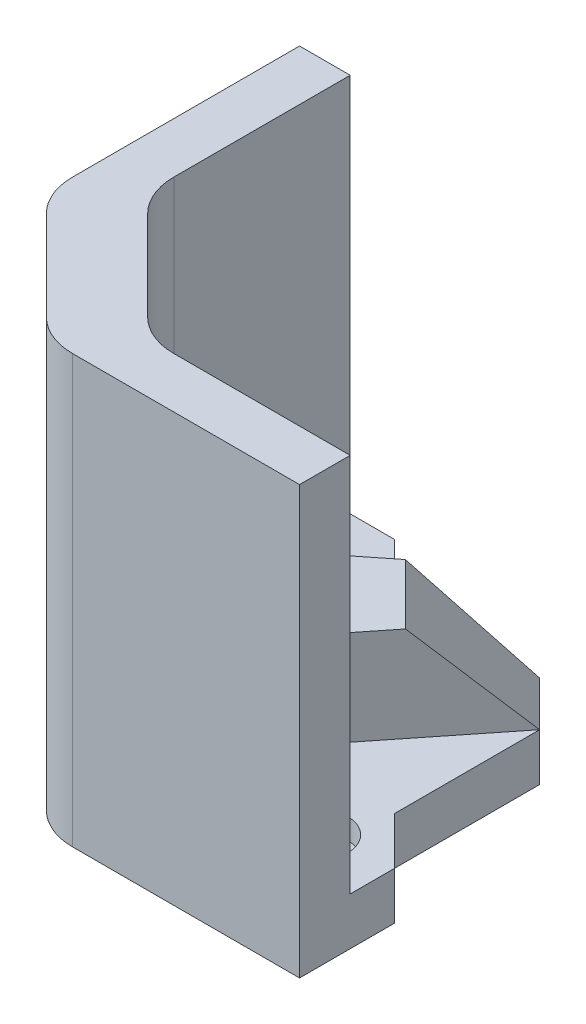
from build123d import *

# Parameters (mm, degrees)
BOSS_EXTRUDE1_DEPTH                                  = 7.5
BOSS_EXTRUDE2_DEPTH                                  = 60
CHAMFER1_SIZE                                        = 20
FILLET2_R                                            = 10
SKETCH3_R                                            = 2.7
CUT_EXTRUDE1_DEPTH                                   = 104.923048454
REFRENTADO_PARA_TORNILLO_CON_CABEZA_PLAN_D           = 5.3
REFRENTADO_PARA_TORNILLO_CON_CABEZA_PLAN_CBORE_D     = 10
REFRENTADO_PARA_TORNILLO_CON_CABEZA_PLAN_CBORE_DEPTH = 3.3
BOSS_EXTRUDE3_DEPTH                                  = 15
CHAMFER2_SIZE                                        = 15


with BuildPart() as part:
    # Sketch1 → Boss-Extrude1 (new body)
    with BuildSketch(Plane(origin=(0, 0, 0), x_dir=(1, 0, 0), z_dir=(0, 1, 0))):
        Polygon((0, 0), (0, 60), (15, 60), (22.5, 52.5), (45.428932188, 52.5), (52.5, 45.428932188), (52.5, 22.5), (60, 15), (60, 0), align=None)
    extrude(amount=BOSS_EXTRUDE1_DEPTH)

    # Sketch2 → Boss-Extrude2 (add)
    with BuildSketch(Plane(origin=(0, 7.5, 0), x_dir=(1, 0, 0), z_dir=(0, 1, 0))):
        Polygon((0, 60), (0, 0), (60, 0), (60, 8), (8, 8), (8, 60), align=None)
    extrude(amount=BOSS_EXTRUDE2_DEPTH)

    # Chamfer1
    chamfer1_edges = [part.edges().sort_by_distance(p)[0] for p in [
        (0, 33.75, 0),
        (8, 37.5, -8),
    ]]
    chamfer(chamfer1_edges, length=CHAMFER1_SIZE)

    # Fillet2
    fillet2_edges = [part.edges().sort_by_distance(p)[0] for p in [
        (0, 33.75, -20),
        (20, 33.75, 0),
        (28, 37.5, -8),
        (8, 37.5, -28),
    ]]
    fillet(fillet2_edges, radius=FILLET2_R)

    # Sketch3 → Cut-Extrude1 (cut, through all)
    with BuildSketch(Plane(origin=(0, 7.5, 0), x_dir=(1, 0, 0), z_dir=(0, 1, 0))):
        with Locations((36.6, 13.4)):
            Circle(SKETCH3_R)
        with Locations((49.187905991, 13.4)):
            Circle(SKETCH3_R)
        with Locations((13.4, 49.187905991)):
            Circle(SKETCH3_R)
        with Locations((13.4, 36.6)):
            Circle(SKETCH3_R)
    extrude(amount=-CUT_EXTRUDE1_DEPTH, mode=Mode.SUBTRACT)

    # Refrentado para tornillo con cabeza plana de M51 (through all)
    with Locations(Plane(origin=(0, 7.5, 0), x_dir=(1, 0, 0), z_dir=(0, 1, 0))):
        with Locations((13.4, 49.187905991), (13.4, 36.6), (36.6, 13.4), (49.187905991, 13.4)):
            CounterBoreHole(REFRENTADO_PARA_TORNILLO_CON_CABEZA_PLAN_D / 2, REFRENTADO_PARA_TORNILLO_CON_CABEZA_PLAN_CBORE_D / 2, REFRENTADO_PARA_TORNILLO_CON_CABEZA_PLAN_CBORE_DEPTH)

    # Sketch5 → Boss-Extrude3 (add)
    with BuildSketch(Plane(origin=(0, 7.5, 0), x_dir=(1, 0, 0), z_dir=(0, 1, 0))):
        Polygon((45.428932188, 52.5), (10.928932188, 25.071067812), (15.346518023, 20.653481977), (18, 18), (20.653481977, 15.346518023), (25.071067812, 10.928932188), (52.5, 45.428932188), align=None)
    extrude(amount=BOSS_EXTRUDE3_DEPTH)

    # Chamfer2
    chamfer2_edges = [part.edges().sort_by_distance(p)[0] for p in [
        (48.964466094, 22.5, -48.964466094),
    ]]
    chamfer(chamfer2_edges, length=CHAMFER2_SIZE)


solid = part.part
